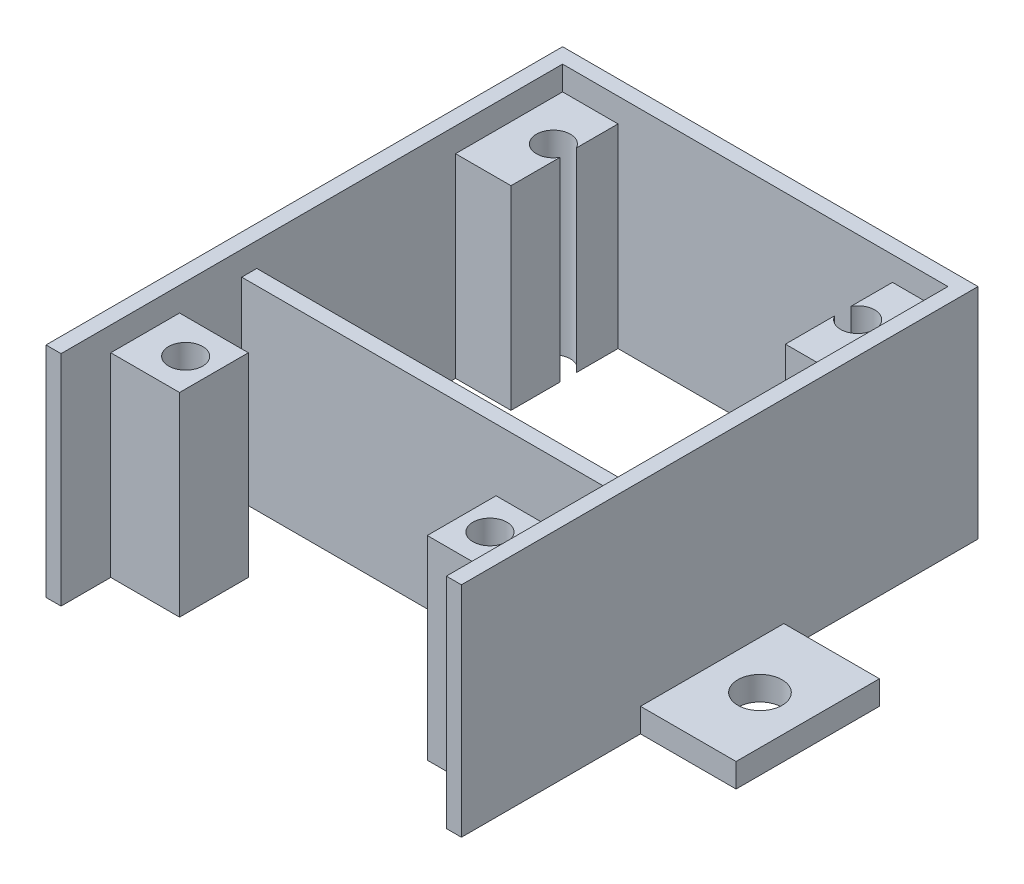
from build123d import *

# Parameters (mm, degrees)
SKETCH1_W           = 27.6032
SKETCH1_H           = 35.3248
SKETCH1_W_2         = 25.6032
SKETCH1_H_2         = 33.3248
MAINCASING_DEPTH    = 12.93
SKETCH2_W           = 6.35
SKETCH2_H           = 9.525
SKETCH2_R           = 1.4732
MOUNTINGTABS_DEPTH  = 1.5875
SKETCH3_W           = 3.683
SKETCH3_H           = 7.112
SKETCH3_W_2         = 4.572
SKETCH3_H_2         = 4.572
SKETCH3_R           = 1.1303
BOSS_EXTRUDE3_DEPTH = 12.93
SKETCH4_W           = 27.6032
SKETCH4_H           = 35.3248
SKETCH4_W_2         = 25.6032
SKETCH4_H_2         = 33.3248
BOSS_EXTRUDE4_DEPTH = 1.6002
SKETCH5_R           = 1.1303
UPPERHOLES_DEPTH    = 38.848662667
SKETCH6_W           = 25.6032
SKETCH6_H           = 1
BOSS_EXTRUDE5_DEPTH = 12.93
SKETCH7_W           = 27.6032
SKETCH7_H           = 1
CUT_EXTRUDE2_DEPTH  = 38.848662667


with BuildPart() as part:
    # Sketch1 → mainCasing (new body)
    with BuildSketch(Plane(origin=(0, 0, 0), x_dir=(1, 0, 0), z_dir=(0, 1, 0))):
        with Locations((2.873828571, -8.628742857)):
            Rectangle(SKETCH1_W, SKETCH1_H)
        with Locations((2.873828571, -8.628742857)):
            Rectangle(SKETCH1_W_2, SKETCH1_H_2, mode=Mode.SUBTRACT)
    extrude(amount=-MAINCASING_DEPTH)

    # Sketch2 → mountingTabs (add)
    # profile 1 of 2: a face of its own
    with BuildSketch(Plane.XZ.offset(12.93)):
        with Locations((-14.102771429, 8.628742857)):
            Rectangle(SKETCH2_W, SKETCH2_H)
        with Locations(Location((-14.102771429, 8.628742857, 0), (0, 0, 270))):
            Circle(SKETCH2_R, mode=Mode.SUBTRACT)
    # profile 2 of 2: a face of its own
    with BuildSketch(Plane.XZ.offset(12.93)):
        with Locations((19.850428571, 8.628742857)):
            Rectangle(SKETCH2_W, SKETCH2_H)
        with Locations(Location((19.850428571, 8.628742857, 0), (0, 0, 270))):
            Circle(SKETCH2_R, mode=Mode.SUBTRACT)
    extrude(amount=-MOUNTINGTABS_DEPTH)

    # Sketch3 → Boss-Extrude3 (add)
    # profile 1 of 4: a face of its own
    with BuildSketch(Plane(origin=(0, 0, 0), x_dir=(1, 0, 0), z_dir=(0, 1, 0))):
        with Locations((-8.086271429, 4.477657143)):
            Rectangle(SKETCH3_W, SKETCH3_H)
    # profile 2 of 4: a face of its own
    with BuildSketch(Plane(origin=(0, 0, 0), x_dir=(1, 0, 0), z_dir=(0, 1, 0))):
        with Locations((13.833928571, 4.477657143)):
            Rectangle(SKETCH3_W, SKETCH3_H)
    # profile 3 of 4: a face of its own
    with BuildSketch(Plane(origin=(0, 0, 0), x_dir=(1, 0, 0), z_dir=(0, 1, 0))):
        with Locations((-7.641771429, -19.703142857)):
            Rectangle(SKETCH3_W_2, SKETCH3_H_2)
        with Locations(Location((-7.235371429, -19.703142857, 0), (0, 0, 270))):
            Circle(SKETCH3_R, mode=Mode.SUBTRACT)
    # profile 4 of 4: a face of its own
    with BuildSketch(Plane(origin=(0, 0, 0), x_dir=(1, 0, 0), z_dir=(0, 1, 0))):
        with Locations((13.389428571, -19.703142857)):
            Rectangle(SKETCH3_W_2, SKETCH3_H_2)
        with Locations(Location((12.983028571, -19.703142857, 0), (0, 0, 270))):
            Circle(SKETCH3_R, mode=Mode.SUBTRACT)
    extrude(amount=-BOSS_EXTRUDE3_DEPTH)

    # Sketch4 → Boss-Extrude4 (add)
    with BuildSketch(Plane(origin=(0, 0, 0), x_dir=(1, 0, 0), z_dir=(0, 1, 0))):
        with Locations((2.873828571, -8.628742857)):
            Rectangle(SKETCH4_W, SKETCH4_H)
        with Locations((2.873828571, -8.628742857)):
            Rectangle(SKETCH4_W_2, SKETCH4_H_2, mode=Mode.SUBTRACT)
    extrude(amount=BOSS_EXTRUDE4_DEPTH)

    # Sketch5 → upperHoles (cut, through all)
    with BuildSketch(Plane.XZ.offset(12.93)):
        with Locations((-7.235371429, -4.731657143)):
            Circle(SKETCH5_R)
        with Locations((12.983028571, -4.731657143)):
            Circle(SKETCH5_R)
    extrude(amount=-UPPERHOLES_DEPTH, mode=Mode.SUBTRACT)

    # Sketch6 → Boss-Extrude5 (add)
    with BuildSketch(Plane.XZ.offset(12.93)):
        with Locations((2.873828571, 12.786342857)):
            Rectangle(SKETCH6_W, SKETCH6_H)
    extrude(amount=-BOSS_EXTRUDE5_DEPTH)

    # Sketch7 → Cut-Extrude2 (cut, through all)
    with BuildSketch(Plane.XZ.offset(12.93)):
        with Locations((2.873828571, 25.791142857)):
            Rectangle(SKETCH7_W, SKETCH7_H)
    extrude(amount=-CUT_EXTRUDE2_DEPTH, mode=Mode.SUBTRACT)


solid = part.part
